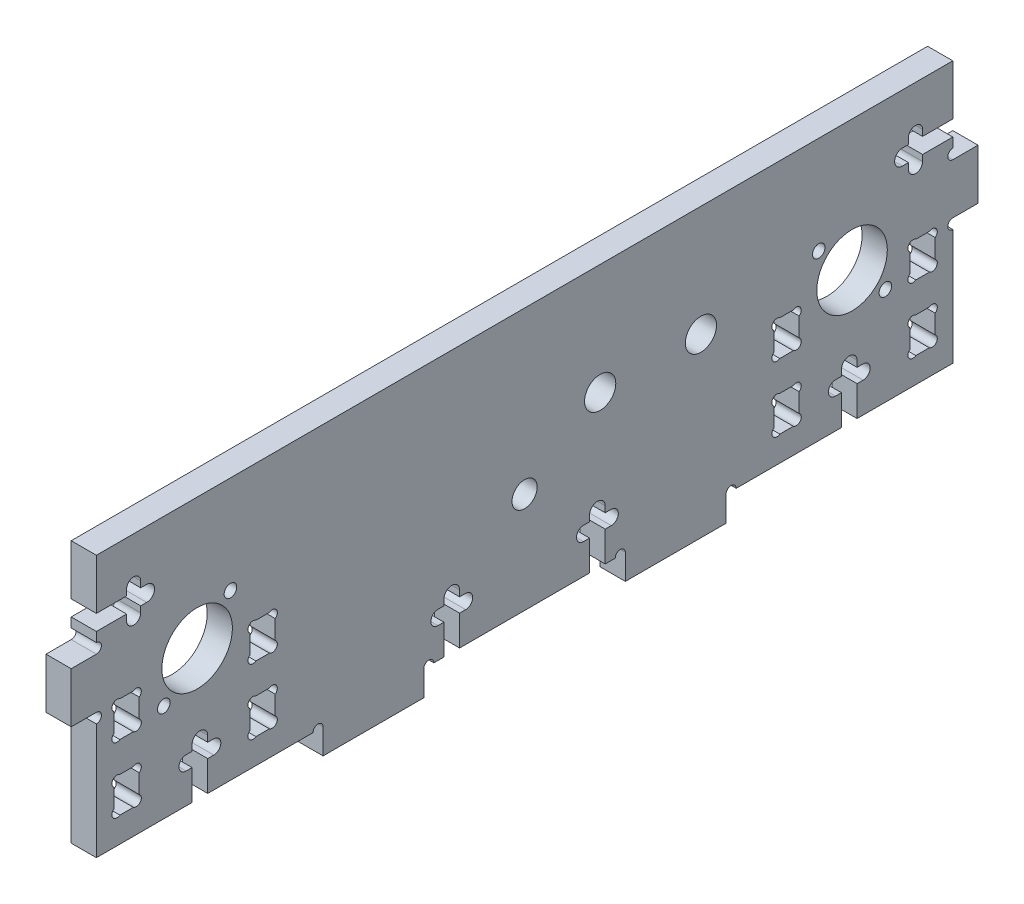
from build123d import *

# Parameters (mm, degrees)
SKETCH_1_W          = 170
SKETCH_1_H          = 52
EXTRUDE_1_DEPTH     = 5
SKETCH_2_R          = 7
CUT_EXTRUDE_1_DEPTH = 10
SKETCH_3_W          = 20
SKETCH_3_H          = 5
EXTRUDE_2_DEPTH     = 5
CUT_EXTRUDE_2_DEPTH = 10
SKETCH_8_W          = 5
SKETCH_8_H          = 10
EXTRUDE_3_DEPTH     = 5
SKETCH_7_R          = 1
CUT_EXTRUDE_3_DEPTH = 10
SKETCH_10_W         = 5
SKETCH_10_H         = 7
CUT_EXTRUDE_4_DEPTH = 10
SKETCH_11_R         = 1
CUT_EXTRUDE_5_DEPTH = 10
CUT_EXTRUDE_6_DEPTH = 10
SKETCH_13_R         = 3.1
SKETCH_13_R_2       = 2.5
CUT_EXTRUDE_7_DEPTH = 10
SKETCH_14_R         = 1.25
CUT_EXTRUDE_8_DEPTH = 10


with BuildPart() as part:
    # 스케치1 → 보스-돌출1 (new body)
    with BuildSketch(Plane(origin=(0, 0, 0), x_dir=(0, 0, -1), z_dir=(1, 0, 0))):
        with Locations((85, 26)):
            Rectangle(SKETCH_1_W, SKETCH_1_H)
    extrude(amount=EXTRUDE_1_DEPTH)

    # 스케치2 → 컷-돌출1 (cut)
    with BuildSketch(Plane(origin=(5, 0, 0), x_dir=(0, 0, -1), z_dir=(1, 0, 0))):
        with Locations((150, 26)):
            Circle(SKETCH_2_R)
        with Locations((20, 26)):
            Circle(SKETCH_2_R)
    extrude(amount=-CUT_EXTRUDE_1_DEPTH, mode=Mode.SUBTRACT)

    # 스케치3 → 보스-돌출2 (add)
    with BuildSketch(Plane(origin=(5, 0, 0), x_dir=(0, 0, -1), z_dir=(1, 0, 0))):
        with Locations((55, -2.5)):
            Rectangle(SKETCH_3_W, SKETCH_3_H)
        with Locations((115, -2.5)):
            Rectangle(SKETCH_3_W, SKETCH_3_H)
    extrude(amount=-EXTRUDE_2_DEPTH)

    # 스케치6 → 컷-돌출2 (cut)
    with BuildSketch(Plane(origin=(5, 0, 0), x_dir=(0, 0, -1), z_dir=(1, 0, 0))):
        with BuildLine():
            Line((151, 0), (151, 6))
            Line((151, 6), (152.2, 6))
            ThreePointArc((152.2, 6), (153.6, 7.4), (152.2, 8.8))
            Line((152.2, 8.8), (151, 8.8))
            Line((151, 8.8), (151, 10))
            ThreePointArc((151, 10), (149.45, 11.55), (147.9, 10))
            Line((147.9, 10), (147.9, 8.8))
            Line((147.9, 8.8), (146.7, 8.8))
            ThreePointArc((146.7, 8.8), (145.3, 7.4), (146.7, 6))
            Line((146.7, 6), (147.9, 6))
            Line((147.9, 6), (147.9, 0))
            Line((147.9, 0), (151, 0))
        make_face()
        with BuildLine():
            Line((101, 0), (101, 6))
            Line((101, 6), (102.2, 6))
            ThreePointArc((102.2, 6), (103.6, 7.4), (102.2, 8.8))
            Line((102.2, 8.8), (101, 8.8))
            Line((101, 8.8), (101, 10))
            ThreePointArc((101, 10), (99.45, 11.55), (97.9, 10))
            Line((97.9, 10), (97.9, 8.8))
            Line((97.9, 8.8), (96.7, 8.8))
            ThreePointArc((96.7, 8.8), (95.3, 7.4), (96.7, 6))
            Line((96.7, 6), (97.9, 6))
            Line((97.9, 6), (97.9, 0))
            Line((97.9, 0), (101, 0))
        make_face()
        with BuildLine():
            Line((67.8, 6), (69, 6))
            Line((69, 6), (69, 0))
            Line((69, 0), (72.1, 0))
            Line((72.1, 0), (72.1, 6))
            Line((72.1, 6), (73.3, 6))
            ThreePointArc((73.3, 6), (74.7, 7.4), (73.3, 8.8))
            Line((73.3, 8.8), (72.1, 8.8))
            Line((72.1, 8.8), (72.1, 10))
            ThreePointArc((72.1, 10), (70.55, 11.55), (69, 10))
            Line((69, 10), (69, 8.8))
            Line((69, 8.8), (67.8, 8.8))
            ThreePointArc((67.8, 8.8), (66.4, 7.4), (67.8, 6))
        make_face()
        with BuildLine():
            Line((17.8, 6), (19, 6))
            Line((19, 6), (19, 0))
            Line((19, 0), (22.1, 0))
            Line((22.1, 0), (22.1, 6))
            Line((22.1, 6), (23.3, 6))
            ThreePointArc((23.3, 6), (24.7, 7.4), (23.3, 8.8))
            Line((23.3, 8.8), (22.1, 8.8))
            Line((22.1, 8.8), (22.1, 10))
            ThreePointArc((22.1, 10), (20.55, 11.55), (19, 10))
            Line((19, 10), (19, 8.8))
            Line((19, 8.8), (17.8, 8.8))
            ThreePointArc((17.8, 8.8), (16.4, 7.4), (17.8, 6))
        make_face()
    extrude(amount=-CUT_EXTRUDE_2_DEPTH, mode=Mode.SUBTRACT)

    # 스케치8 → 보스-돌출3 (add)
    with BuildSketch(Plane(origin=(5, 0, 0), x_dir=(0, 0, -1), z_dir=(1, 0, 0))):
        with Locations((172.5, 30)):
            Rectangle(SKETCH_8_W, SKETCH_8_H)
        with Locations((-2.5, 30)):
            Rectangle(SKETCH_8_W, SKETCH_8_H)
    extrude(amount=-EXTRUDE_3_DEPTH)

    # 스케치7 → 컷-돌출3 (cut)
    with BuildSketch(Plane(origin=(5, 0, 0), x_dir=(0, 0, -1), z_dir=(1, 0, 0))):
        with Locations((66, 0)):
            Circle(SKETCH_7_R)
        with Locations((44, 0)):
            Circle(SKETCH_7_R)
        with Locations((104, 0)):
            Circle(SKETCH_7_R)
        with Locations((126, 0)):
            Circle(SKETCH_7_R)
        with Locations((170, 36)):
            Circle(SKETCH_7_R)
        with Locations((170, 24)):
            Circle(SKETCH_7_R)
        with Locations((0, 36)):
            Circle(SKETCH_7_R)
        with Locations((0, 24)):
            Circle(SKETCH_7_R)
    extrude(amount=-CUT_EXTRUDE_3_DEPTH, mode=Mode.SUBTRACT)

    # 스케치10 → 컷-돌출4 (cut)
    with BuildSketch(Plane.ZY):
        with Locations((-164, 21.5)):
            Rectangle(SKETCH_10_W, SKETCH_10_H)
        with Locations((-137, 21.5)):
            Rectangle(SKETCH_10_W, SKETCH_10_H)
        with Locations((-164, 8.5)):
            Rectangle(SKETCH_10_W, SKETCH_10_H)
        with Locations((-137, 8.5)):
            Rectangle(SKETCH_10_W, SKETCH_10_H)
        with Locations((-33, 8.5)):
            Rectangle(SKETCH_10_W, SKETCH_10_H)
        with Locations((-6, 8.5)):
            Rectangle(SKETCH_10_W, SKETCH_10_H)
        with Locations((-33, 21.5)):
            Rectangle(SKETCH_10_W, SKETCH_10_H)
        with Locations((-6, 21.5)):
            Rectangle(SKETCH_10_W, SKETCH_10_H)
    extrude(amount=-CUT_EXTRUDE_4_DEPTH, mode=Mode.SUBTRACT)

    # 스케치11 → 컷-돌출5 (cut)
    with BuildSketch(Plane(origin=(5, 0, 0), x_dir=(0, 0, -1), z_dir=(1, 0, 0))):
        with Locations((165.918761806, 24.186266529)):
            Circle(SKETCH_11_R)
        with Locations((162.081238194, 24.186266529)):
            Circle(SKETCH_11_R)
        with Locations((165.918761806, 18.813733471)):
            Circle(SKETCH_11_R)
        with Locations((162.081238194, 18.813733471)):
            Circle(SKETCH_11_R)
        with Locations((138.918761806, 18.813733471)):
            Circle(SKETCH_11_R)
        with Locations((135.081238194, 18.813733471)):
            Circle(SKETCH_11_R)
        with Locations((138.918761806, 24.186266529)):
            Circle(SKETCH_11_R)
        with Locations((135.081238194, 24.186266529)):
            Circle(SKETCH_11_R)
        with Locations((135.081238194, 5.813733471)):
            Circle(SKETCH_11_R)
        with Locations((138.918761806, 5.813733471)):
            Circle(SKETCH_11_R)
        with Locations((135.081238194, 11.186266529)):
            Circle(SKETCH_11_R)
        with Locations((138.918761806, 11.186266529)):
            Circle(SKETCH_11_R)
        with Locations((162.081238194, 11.186266529)):
            Circle(SKETCH_11_R)
        with Locations((165.918761806, 11.186266529)):
            Circle(SKETCH_11_R)
        with Locations((162.081238194, 5.813733471)):
            Circle(SKETCH_11_R)
        with Locations((165.918761806, 5.813733471)):
            Circle(SKETCH_11_R)
        with Locations((4.081238194, 5.813733471)):
            Circle(SKETCH_11_R)
        with Locations((7.918761806, 5.813733471)):
            Circle(SKETCH_11_R)
        with Locations((4.081238194, 11.186266529)):
            Circle(SKETCH_11_R)
        with Locations((7.918761806, 11.186266529)):
            Circle(SKETCH_11_R)
        with Locations((31.081238194, 11.186266529)):
            Circle(SKETCH_11_R)
        with Locations((34.918761806, 11.186266529)):
            Circle(SKETCH_11_R)
        with Locations((31.081238194, 5.813733471)):
            Circle(SKETCH_11_R)
        with Locations((34.918761806, 5.813733471)):
            Circle(SKETCH_11_R)
        with Locations((34.918761806, 24.186266529)):
            Circle(SKETCH_11_R)
        with Locations((31.081238194, 24.186266529)):
            Circle(SKETCH_11_R)
        with Locations((34.918761806, 18.813733471)):
            Circle(SKETCH_11_R)
        with Locations((31.081238194, 18.813733471)):
            Circle(SKETCH_11_R)
        with Locations((7.918761806, 18.813733471)):
            Circle(SKETCH_11_R)
        with Locations((4.081238194, 18.813733471)):
            Circle(SKETCH_11_R)
        with Locations((7.918761806, 24.186266529)):
            Circle(SKETCH_11_R)
        with Locations((4.081238194, 24.186266529)):
            Circle(SKETCH_11_R)
    extrude(amount=-CUT_EXTRUDE_5_DEPTH, mode=Mode.SUBTRACT)

    # 스케치12 → 컷-돌출6 (cut)
    with BuildSketch(Plane(origin=(5, 0, 0), x_dir=(0, 0, -1), z_dir=(1, 0, 0))):
        with BuildLine():
            Line((170, 42), (164, 42))
            Line((164, 42), (164, 43.2))
            ThreePointArc((164, 43.2), (162.6, 44.6), (161.2, 43.2))
            Line((161.2, 43.2), (161.2, 42))
            Line((161.2, 42), (160, 42))
            ThreePointArc((160, 42), (158.45, 40.45), (160, 38.9))
            Line((160, 38.9), (161.2, 38.9))
            Line((161.2, 38.9), (161.2, 37.7))
            ThreePointArc((161.2, 37.7), (162.6, 36.3), (164, 37.7))
            Line((164, 37.7), (164, 38.9))
            Line((164, 38.9), (170, 38.9))
            Line((170, 38.9), (170, 42))
        make_face()
        with BuildLine():
            Line((6, 43.2), (6, 42))
            Line((6, 42), (0, 42))
            Line((0, 42), (0, 38.9))
            Line((0, 38.9), (6, 38.9))
            Line((6, 38.9), (6, 37.7))
            ThreePointArc((6, 37.7), (7.4, 36.3), (8.8, 37.7))
            Line((8.8, 37.7), (8.8, 38.9))
            Line((8.8, 38.9), (10, 38.9))
            ThreePointArc((10, 38.9), (11.55, 40.45), (10, 42))
            Line((10, 42), (8.8, 42))
            Line((8.8, 42), (8.8, 43.2))
            ThreePointArc((8.8, 43.2), (7.4, 44.6), (6, 43.2))
        make_face()
    extrude(amount=-CUT_EXTRUDE_6_DEPTH, mode=Mode.SUBTRACT)

    # 스케치13 → 컷-돌출7 (cut)
    with BuildSketch(Plane(origin=(5, 0, 0), x_dir=(0, 0, -1), z_dir=(1, 0, 0))):
        with Locations((100, 30)):
            Circle(SKETCH_13_R)
        with Locations((120, 30)):
            Circle(SKETCH_13_R)
        with Locations((85, 20)):
            Circle(SKETCH_13_R_2)
    extrude(amount=-CUT_EXTRUDE_7_DEPTH, mode=Mode.SUBTRACT)

    # 스케치14 → 컷-돌출8 (cut)
    with BuildSketch(Plane(origin=(5, 0, 0), x_dir=(0, 0, -1), z_dir=(1, 0, 0))):
        with Locations((156.611448404, 19.388551596)):
            Circle(SKETCH_14_R)
        with Locations((143.388551596, 32.611448404)):
            Circle(SKETCH_14_R)
        with Locations((13.388551596, 19.388551596)):
            Circle(SKETCH_14_R)
        with Locations((26.611448404, 32.611448404)):
            Circle(SKETCH_14_R)
    extrude(amount=-CUT_EXTRUDE_8_DEPTH, mode=Mode.SUBTRACT)


solid = part.part
